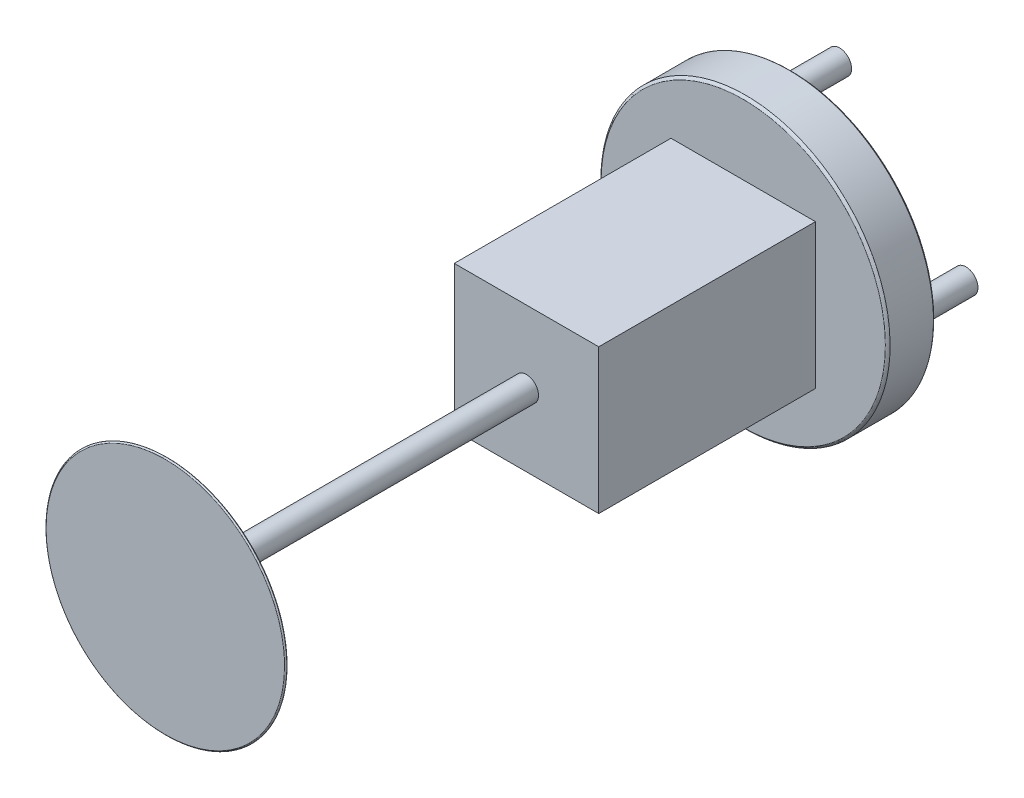
from build123d import *

# Parameters (mm, degrees)
SKETCH1_R           = 60
BOSS_EXTRUDE1_DEPTH = 20
FILLET1_SIZE        = 1
FILLET2_SIZE        = 1
SKETCH2_R           = 5
BOSS_EXTRUDE2_DEPTH = 20
SKETCH3_W           = 60
SKETCH3_H           = 60
BOSS_EXTRUDE3_DEPTH = 90
SKETCH4_R           = 5
BOSS_EXTRUDE4_DEPTH = 150
SKETCH5_R           = 50
BOSS_EXTRUDE5_DEPTH = 1
FILLET3_SIZE        = 0.5


with BuildPart() as part:
    # Sketch1 → Boss-Extrude1 (new body)
    with BuildSketch(Plane.XY):
        Circle(SKETCH1_R)
    extrude(amount=BOSS_EXTRUDE1_DEPTH)

    # Fillet1
    # a fillet whose section is not a circle: 1 mm, written as the material it takes off along each edge
    with BuildSketch(Plane(origin=(0, 0, 0), x_dir=(1, 0, 0), z_dir=(0, -1, 0))) as fillet1_piece_1:
        with BuildLine():
            Bezier((60, FILLET1_SIZE), (60, 0), (60 - FILLET1_SIZE, 0), weights=[1, 0.111111111, 1])
            Line((60 - FILLET1_SIZE, 0), (60, 0))
            Line((60, 0), (60, FILLET1_SIZE))
        make_face()
    revolve(axis=Axis((0, 0, 0), (0, 0, 1)), mode=Mode.SUBTRACT)

    # Fillet2
    # a fillet whose section is not a circle: 1 mm, written as the material it takes off along each edge
    with BuildSketch(Plane(origin=(0, 0, 20), x_dir=(1, 0, 0), z_dir=(0, -1, 0))) as fillet2_piece_1:
        with BuildLine():
            Bezier((60, -FILLET2_SIZE), (60, 0), (60 - FILLET2_SIZE, 0), weights=[1, 0.111111111, 1])
            Line((60 - FILLET2_SIZE, 0), (60, 0))
            Line((60, 0), (60, -FILLET2_SIZE))
        make_face()
    revolve(axis=Axis((0, 0, 20), (0, 0, 1)), mode=Mode.SUBTRACT)

    # Sketch2 → Boss-Extrude2 (add)
    with BuildSketch(Plane(origin=(0, 0, 0), x_dir=(-1, 0, 0), z_dir=(0, 0, -1))):
        with Locations(Location((0, 52.5, 0), (0, 0, 180))):
            Circle(SKETCH2_R)
        with Locations(Location((52.5, 0, 0), (0, 0, 180))):
            Circle(SKETCH2_R)
        with Locations(Location((0, -52.5, 0), (0, 0, 180))):
            Circle(SKETCH2_R)
        with Locations(Location((-52.5, 0, 0), (0, 0, 180))):
            Circle(SKETCH2_R)
    extrude(amount=BOSS_EXTRUDE2_DEPTH)

    # Sketch3 → Boss-Extrude3 (add)
    with BuildSketch(Plane.XY.offset(20)):
        Rectangle(SKETCH3_W, SKETCH3_H)
    extrude(amount=BOSS_EXTRUDE3_DEPTH)

    # Sketch4 → Boss-Extrude4 (add)
    with BuildSketch(Plane.XY.offset(110)):
        Circle(SKETCH4_R)
    extrude(amount=BOSS_EXTRUDE4_DEPTH)

    # Sketch5 → Boss-Extrude5 (add)
    with BuildSketch(Plane.XY.offset(260)):
        Circle(SKETCH5_R)
    extrude(amount=-BOSS_EXTRUDE5_DEPTH)

    # Fillet3
    # a fillet whose section is not a circle: 0.5 mm, written as the material it takes off along each edge
    with BuildSketch(Plane(origin=(0, 0, 259), x_dir=(1, 0, 0), z_dir=(0, -1, 0))) as fillet3_piece_1:
        with BuildLine():
            Bezier((50 - FILLET3_SIZE, 0), (50, 0), (50, FILLET3_SIZE), weights=[1, 0.111111111, 1])
            Line((50, FILLET3_SIZE), (50, 0))
            Line((50, 0), (50 - FILLET3_SIZE, 0))
        make_face()
    revolve(axis=Axis((0, 0, 259), (0, 0, 1)), mode=Mode.SUBTRACT)
    with BuildSketch(Plane(origin=(0, 0, 260), x_dir=(1, 0, 0), z_dir=(0, -1, 0))) as fillet3_piece_2:
        with BuildLine():
            Bezier((50, -FILLET3_SIZE), (50, 0), (50 - FILLET3_SIZE, 0), weights=[1, 0.111111111, 1])
            Line((50 - FILLET3_SIZE, 0), (50, 0))
            Line((50, 0), (50, -FILLET3_SIZE))
        make_face()
    revolve(axis=Axis((0, 0, 260), (0, 0, 1)), mode=Mode.SUBTRACT)


solid = part.part
